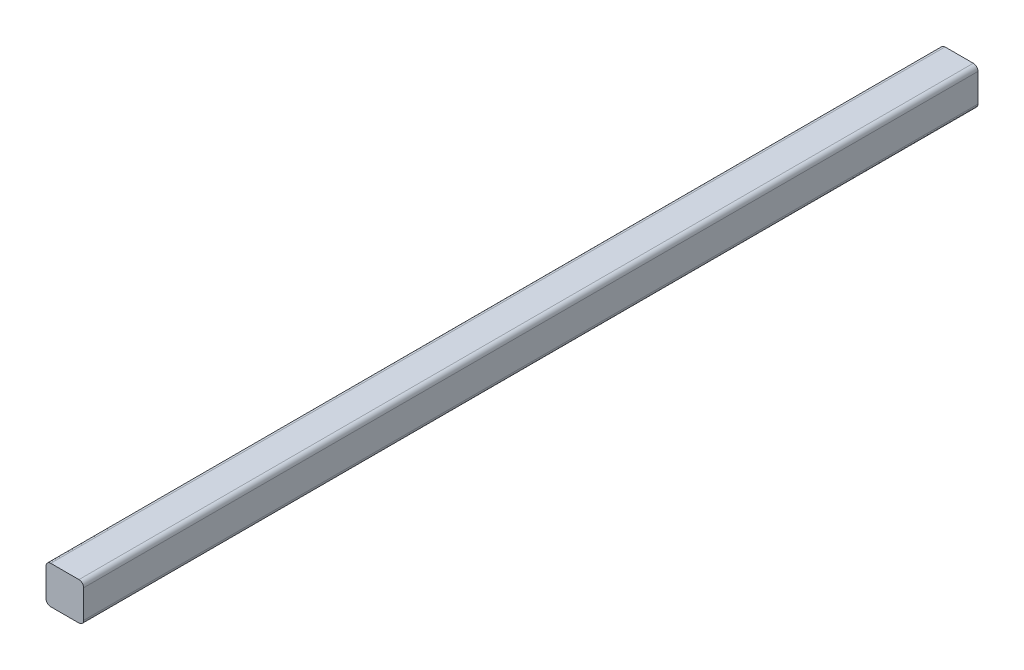
from build123d import *

# Parameters (mm, degrees)
SKETCH3_W           = 4
SKETCH3_H           = 4
BOSS_EXTRUDE1_DEPTH = 95
FILLET1_R           = 0.5


with BuildPart() as part:
    # Sketch3 → Boss-Extrude1 (new body)
    with BuildSketch(Plane.XY):
        Rectangle(SKETCH3_W, SKETCH3_H)
    extrude(amount=BOSS_EXTRUDE1_DEPTH)

    # Fillet1
    fillet1_edges = [part.edges().sort_by_distance(p)[0] for p in [
        (2, 2, 47.5),
        (2, -2, 47.5),
        (-2, -2, 47.5),
        (-2, 2, 47.5),
    ]]
    fillet(fillet1_edges, radius=FILLET1_R)


solid = part.part
